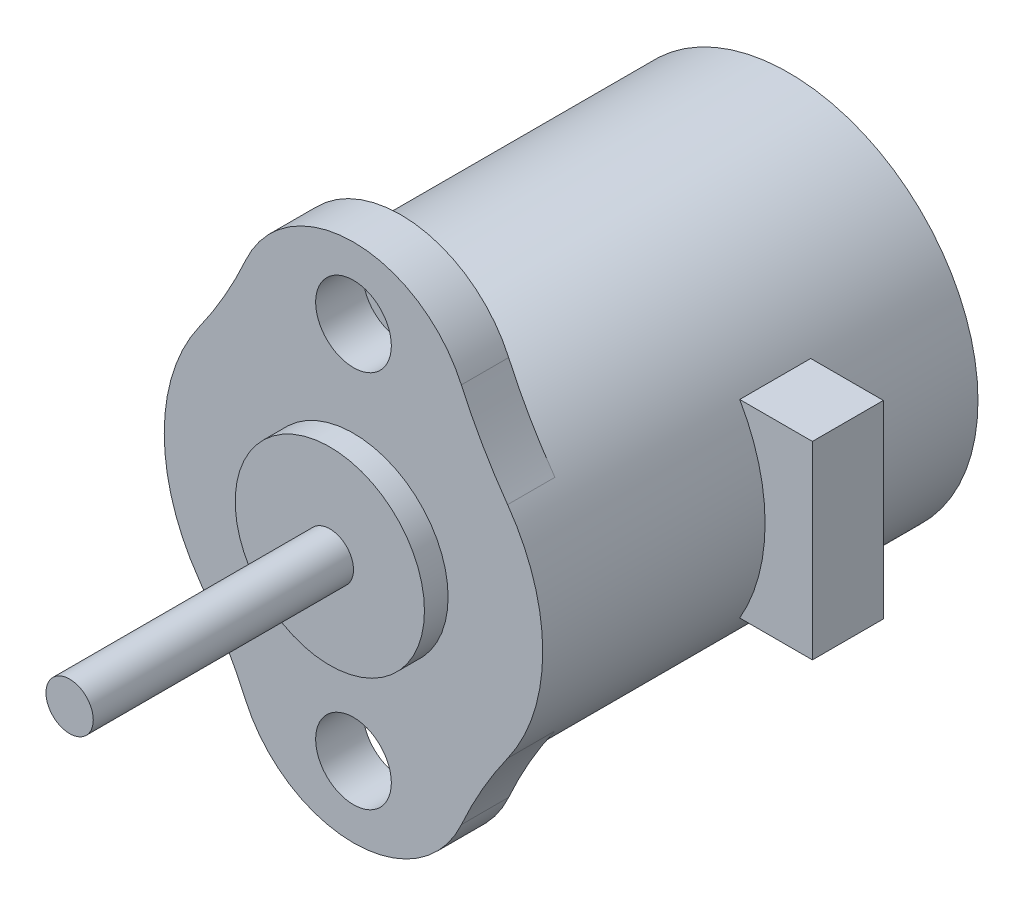
from build123d import *

# Parameters (mm, degrees)
SKETCH_2_R      = 4
EXTRUDE_1_DEPTH = 8.2
SKETCH_4_R      = 0.5
EXTRUDE_2_DEPTH = 7
SKETCH_5_R      = 1.5
EXTRUDE_3_DEPTH = 1
SKETCH_6_W      = 1.5
SKETCH_6_H      = 4
EXTRUDE_4_DEPTH = 5
EXTRUDE_5_DEPTH = 1
FILLET_1_R      = 10
SKETCH_8_R      = 2
EXTRUDE_6_DEPTH = 0.5


with BuildPart() as part:
    # 草图2 → 凸台-拉伸1 (new body)
    with BuildSketch(Plane.XY):
        Circle(SKETCH_2_R)
    extrude(amount=EXTRUDE_1_DEPTH)

    # 草图4 → 凸台-拉伸2 (add)
    with BuildSketch(Plane.XY.offset(8.2)):
        Circle(SKETCH_4_R)
    extrude(amount=EXTRUDE_2_DEPTH)

    # 草图5 → 凸台-拉伸3 (add)
    with BuildSketch(Plane.XY.offset(8.2)):
        Circle(SKETCH_5_R)
    extrude(amount=EXTRUDE_3_DEPTH)

    # 草图6 → 凸台-拉伸4 (add)
    with BuildSketch(Plane(origin=(0, 0, 0), x_dir=(0, 0, -1), z_dir=(1, 0, 0))):
        with Locations((-3.75, 0)):
            Rectangle(SKETCH_6_W, SKETCH_6_H)
    extrude(amount=EXTRUDE_4_DEPTH)

    # 草图7 → 凸台-拉伸5 (add)
    with BuildSketch(Plane.XY.offset(8.2)):
        with BuildLine():
            Line((4, 0), (1.5, 0))
            ThreePointArc((1.5, 0), (0, -1.5), (-1.5, 0))
            Line((-1.5, 0), (-4, 0))
            ThreePointArc((-4, 0), (-3.60468391, -1.733855216), (-2.496873044, -3.125))
            ThreePointArc((-2.496873044, -3.125), (-1.69373638, -3.623707642), (-0.79598995, -3.92))
            ThreePointArc((-0.79598995, -3.92), (0, -3.2), (0.79598995, -3.92))
            ThreePointArc((0.79598995, -3.92), (1.69373638, -3.623707642), (2.496873044, -3.125))
            ThreePointArc((2.496873044, -3.125), (3.60468391, -1.733855216), (4, 0))
        make_face()
        with BuildLine():
            ThreePointArc((-2.496873044, -3.125), (0, -5.5), (2.496873044, -3.125))
            ThreePointArc((2.496873044, -3.125), (1.69373638, -3.623707642), (0.79598995, -3.92))
            ThreePointArc((0.79598995, -3.92), (0.798996858, -3.95994978), (0.8, -4))
            ThreePointArc((0.8, -4), (-0.04005022, -4.798996858), (-0.79598995, -3.92))
            ThreePointArc((-0.79598995, -3.92), (-1.69373638, -3.623707642), (-2.496873044, -3.125))
        make_face()
        with BuildLine():
            ThreePointArc((-1.5, 0), (0, 1.5), (1.5, 0))
            Line((1.5, 0), (4, 0))
            ThreePointArc((4, 0), (3.60468391, 1.733855216), (2.496873044, 3.125))
            ThreePointArc((2.496873044, 3.125), (1.69373638, 3.623707642), (0.79598995, 3.92))
            ThreePointArc((0.79598995, 3.92), (0, 3.2), (-0.79598995, 3.92))
            ThreePointArc((-0.79598995, 3.92), (-1.69373638, 3.623707642), (-2.496873044, 3.125))
            ThreePointArc((-2.496873044, 3.125), (-3.60468391, 1.733855216), (-4, 0))
            Line((-4, 0), (-1.5, 0))
        make_face()
        with BuildLine():
            ThreePointArc((0.79598995, 3.92), (1.69373638, 3.623707642), (2.496873044, 3.125))
            ThreePointArc((2.496873044, 3.125), (0, 5.5), (-2.496873044, 3.125))
            ThreePointArc((-2.496873044, 3.125), (-1.69373638, 3.623707642), (-0.79598995, 3.92))
            ThreePointArc((-0.79598995, 3.92), (-0.04005022, 4.798996858), (0.8, 4))
            ThreePointArc((0.8, 4), (0.798996858, 3.95994978), (0.79598995, 3.92))
        make_face()
    extrude(amount=EXTRUDE_5_DEPTH)

    # 圆角1
    # the kernel refuses this fillet: 10 mm, written as the material it adds along each edge
    with BuildSketch(Plane(origin=(2.496873044, 3.125, 8.2), x_dir=(0.6874097542343248, -0.7262698050886497, 0), z_dir=(0, 0, 1)), Plane(origin=(-2.496873044, -3.125, 8.2), x_dir=(-0.6874097542343238, 0.7262698050886505, 0), z_dir=(0, 0, 1))) as fillet_1_piece_1:
        with BuildLine():
            CenterArc((2.489482148, 9.903897453), FILLET_1_R, 250.779418195, 11.270831285)
            ThreePointArc((-0.802576499, 0.461315716), (-0.379749812, 0.26812947), (0, 0))
            ThreePointArc((0, 0), (0.553218255, 0.038441019), (1.10643651, 0))
        make_face()
    extrude(amount=1)
    with BuildSketch(Plane(origin=(-2.496873044, 3.125, 8.2), x_dir=(-0.6874097542343243, -0.7262698050886502, 0), z_dir=(0, 0, 1)), Plane(origin=(2.496873044, -3.125, 8.2), x_dir=(0.6874097542343256, 0.7262698050886488, 0), z_dir=(0, 0, 1))) as fillet_1_piece_2:
        with BuildLine():
            CenterArc((2.489482148, -9.903897453), FILLET_1_R, 97.94975052, 11.270831285)
            ThreePointArc((-0.802576499, -0.461315716), (-0.379749812, -0.26812947), (0, 0))
            ThreePointArc((0, 0), (0.553218255, -0.038441019), (1.10643651, 0))
        make_face()
    extrude(amount=1)

    # 草图8 → 凸台-拉伸6 (add)
    with BuildSketch(Plane.XY.offset(9.2)):
        Circle(SKETCH_8_R)
    extrude(amount=EXTRUDE_6_DEPTH)


solid = part.part
